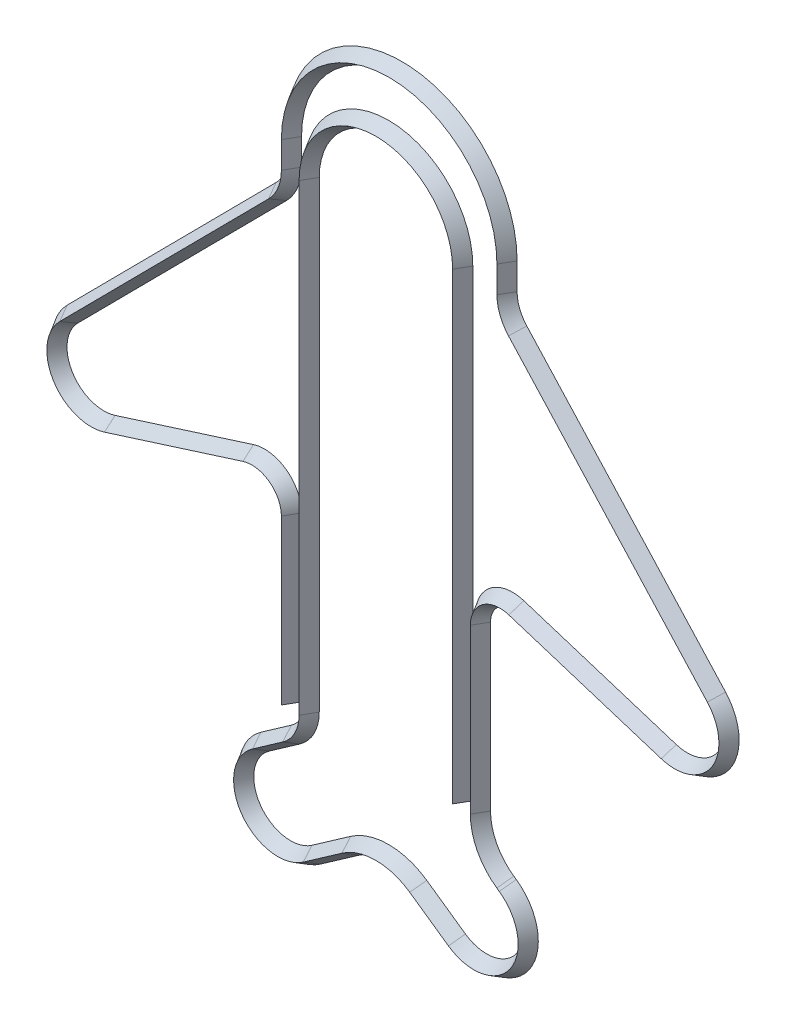
from build123d import *


with BuildPart() as part:
    # По траектории1: sweep along a path in Эскиз1
    with BuildLine(Plane.XY) as sweep_1_path:
        Line((-32, 25.148504502), (-32, 80.554120844))
        ThreePointArc((-32, 80.554120844), (-36.093720461, 88.62356085), (-45.023172402, 90.086194523))
        Line((-45.023172402, 90.086194523), (-91.886551199, 75.223104055))
        ThreePointArc((-91.886551199, 75.223104055), (-109.221949163, 81.70177521), (-107.072543722, 100.082995484))
        Line((-107.072543722, 100.082995484), (-36.34876608, 171.405768201))
        ThreePointArc((-36.34876608, 171.405768201), (-33.129734884, 176.256529446), (-32, 181.967549111))
        Line((-32, 181.967549111), (-32, 190.967549111))
        ThreePointArc((-32, 190.967549111), (4.5, 227.467549111), (41, 190.967549111))
        Line((41, 190.967549111), (41, 181.967549111))
        ThreePointArc((41, 181.967549111), (42.015292796, 176.54279433), (44.92372859, 171.852401477))
        Line((44.92372859, 171.852401477), (112.249755104, 98.129172749))
        ThreePointArc((112.249755104, 98.129172749), (113.81071602, 79.933161353), (96.638725091, 73.715914597))
        Line((96.638725091, 73.715914597), (45.023172402, 90.086194523))
        ThreePointArc((45.023172402, 90.086194523), (36.093720461, 88.62356085), (32, 80.554120844))
        Line((32, 80.554120844), (32, 25.148504502))
        ThreePointArc((32, 25.148504502), (34.372772503, 15.451783624), (40.954894837, 7.946311572))
        Line((40.954894837, 7.946311572), (41.781854419, 7.367268238))
        ThreePointArc((41.781854419, 7.367268238), (45.465488538, -13.523658971), (24.574561329, -17.207293091))
        Line((24.574561329, -17.207293091), (11.471528727, -8.032450889))
        ThreePointArc((11.471528727, -8.032450889), (0, -4.415491775), (-11.471528727, -8.032450889))
        Line((-11.471528727, -8.032450889), (-24.574561329, -17.207293091))
        ThreePointArc((-24.574561329, -17.207293091), (-45.465488538, -13.523658971), (-41.781854419, 7.367268238))
        Line((-41.781854419, 7.367268238), (-31.513436219, 14.557292068))
        ThreePointArc((-31.513436219, 14.557292068), (-27.460891512, 19.178333655), (-26, 25.148504502))
        Line((-26, 25.148504502), (-26, 181.967549111))
        ThreePointArc((-26, 181.967549111), (0, 207.967549111), (26, 181.967549111))
        Line((26, 181.967549111), (26, 25.148504502))
    # Эскиз2 → По траектории1 (sweep)
    with BuildSketch(Plane(origin=(0, 25.148504502, 0), x_dir=(1, 0, 0), z_dir=(0, 1, 0))):
        Polygon((26, -2.886751346), (28.5, 1.443375673), (23.5, 1.443375673), align=None)
    sweep(path=sweep_1_path.line)


solid = part.part
